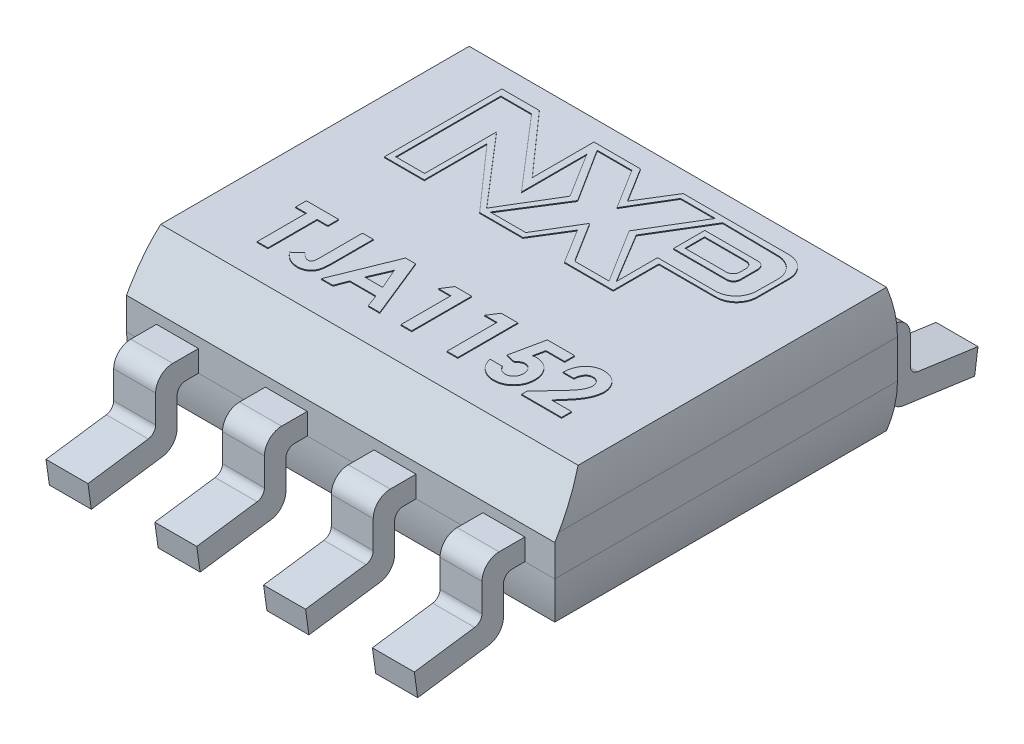
from build123d import *
from OCP.BRepAlgoAPI import BRepAlgoAPI_Cut
from OCP.TopTools import TopTools_ListOfShape

# Parameters (mm, degrees)
SKETCH1_W           = 5
SKETCH1_H           = 4
BOSS_EXTRUDE1_DEPTH = 1.45
CUT_EXTRUDE1_DEPTH  = 61.45
CUT_EXTRUDE2_DEPTH  = 61.45
BOSS_EXTRUDE2_DEPTH = 5
SKETCH7_W           = 0.35
SKETCH7_H           = 1.533953372
SKETCH7_W_2         = 0.78
SKETCH7_H_2         = 1.610570248
SKETCH7_H_3         = 1.782958217
SKETCH7_H_4         = 1.677610014
CUT_EXTRUDE3_DEPTH  = 61.45
BOSS_EXTRUDE3_DEPTH = 0.01
BOSS_EXTRUDE4_DEPTH = 0.01


with BuildPart() as part:
    # Sketch1 → Boss-Extrude1 (new body)
    with BuildSketch(Plane(origin=(0, 0, 0), x_dir=(1, 0, 0), z_dir=(0, 1, 0))):
        Rectangle(SKETCH1_W, SKETCH1_H)
    extrude(amount=BOSS_EXTRUDE1_DEPTH)

    # Sketch2 → Cut-Extrude1 (cut)
    with BuildSketch(Plane.ZY.offset(2.5)):
        Polygon((2, 0.86865368), (1.664359546, 1.45), (1.664359546, 1.731681291), (2.487143748, 1.731681291), (2.487143748, 0.86865368), align=None)
        with BuildLine():
            Line((-1.864420937, 1.672264495), (-2.155873567, 1.672264495))
            Line((-2.155873567, 1.672264495), (-2.155873567, 0.954004167))
            Line((-2.155873567, 0.954004167), (-1.999984404, 0.948389144))
            ThreePointArc((-1.999984404, 0.948389144), (-1.965805293, 1.316619369), (-1.864420937, 1.672264495))
        make_face()
        with BuildLine():
            Line((-1.999984404, 0.501610856), (-2.15587357, 0.501610856))
            Line((-2.15587357, 0.501610856), (-2.15587357, -0.22229559))
            Line((-2.15587357, -0.22229559), (-1.864420937, -0.222264495))
            ThreePointArc((-1.864420937, -0.222264495), (-1.965805293, 0.133380631), (-1.999984404, 0.501610856))
        make_face()
        with BuildLine():
            Line((2, 0.501548667), (2.487143748, 0.501548667))
            Line((2.487143748, 0.501548667), (2.487143748, -0.222291374))
            Line((2.487143748, -0.222291374), (1.864414025, -0.222322469))
            ThreePointArc((1.864414025, -0.222322469), (1.965809439, 0.133319505), (2, 0.501548667))
        make_face()
    extrude(amount=-CUT_EXTRUDE1_DEPTH, mode=Mode.SUBTRACT)


with BuildPart() as cut_extrude2_tool:
    # Sketch5 → Cut-Extrude2 (new body)
    with BuildSketch(Plane(origin=(0, 0, -2), x_dir=(-1, 0, 0), z_dir=(0, 0, -1))):
        with BuildLine():
            Line((-2.655873567, 0.954004878), (-2.499991937, 0.948390126))
            ThreePointArc((-2.499991937, 0.948390126), (-2.46581276, 1.316621068), (-2.364420937, 1.672264066))
            Line((-2.364420937, 1.672264066), (-2.655873567, 1.672264066))
            Line((-2.655873567, 1.672264066), (-2.655873567, 0.954004878))
        make_face()
        with BuildLine():
            ThreePointArc((-2.364420937, -0.222263785), (-2.46581276, 0.133379212), (-2.499991937, 0.501610155))
            Line((-2.499991937, 0.501610155), (-2.655873567, 0.495995403))
            Line((-2.65587357, 0.495995403), (-2.65587357, -0.22229488))
            Line((-2.65587357, -0.22229488), (-2.364420937, -0.222263785))
        make_face()
        with BuildLine():
            ThreePointArc((2.499991937, 0.948390126), (2.46581276, 1.316621068), (2.364420937, 1.672264066))
            Line((2.364420937, 1.672264066), (2.655873567, 1.672264066))
            Line((2.655873567, 1.672264066), (2.655873567, 0.954004878))
            Line((2.655873567, 0.954004878), (2.499991937, 0.948390126))
        make_face()
        with BuildLine():
            Line((2.499991937, 0.501610155), (2.65587357, 0.501610155))
            Line((2.65587357, 0.501610155), (2.65587357, -0.22229488))
            Line((2.65587357, -0.22229488), (2.364420937, -0.222263785))
            ThreePointArc((2.364420937, -0.222263785), (2.46581276, 0.133379212), (2.499991937, 0.501610155))
        make_face()
    extrude(amount=-CUT_EXTRUDE2_DEPTH)


with BuildPart() as part_1:
    add(part.part)

    # Cut-Extrude2: cut by cut_extrude2_tool, with a tolerance
    cut_extrude2_stock = TopTools_ListOfShape()
    cut_extrude2_stock.Append(part_1.part.wrapped)
    cut_extrude2_tools = TopTools_ListOfShape()
    cut_extrude2_tools.Append(cut_extrude2_tool.part.wrapped)
    cut_extrude2_cut = BRepAlgoAPI_Cut()
    cut_extrude2_cut.SetArguments(cut_extrude2_stock)
    cut_extrude2_cut.SetTools(cut_extrude2_tools)
    cut_extrude2_cut.SetFuzzyValue(0.00001)
    cut_extrude2_cut.Build()
    add(Compound.cast(cut_extrude2_cut.Shape()).solids(), mode=Mode.REPLACE)

    # Sketch6 → Boss-Extrude2 (add)
    with BuildSketch(Plane.ZY.offset(2.5)):
        with BuildLine():
            Line((2.300001958, 0.75), (2.253544498, 0.75))
            Line((2.253544498, 0.75), (-2.253544498, 0.75))
            Line((-2.253544498, 0.75), (-2.300001958, 0.75))
            ThreePointArc((-2.300001958, 0.75), (-2.441423314, 0.691421356), (-2.500001958, 0.55))
            Line((-2.500001958, 0.55), (-2.500001958, 0.227578594))
            ThreePointArc((-2.500001958, 0.227578594), (-2.524531, 0.161972691), (-2.586084648, 0.128551787))
            Line((-2.586084648, 0.128551787), (-3.290075098, 0.029612381))
            Line((-3.290075098, 0.029612381), (-3.250778141, -0.25))
            Line((-3.250778141, -0.25), (-2.422167338, -0.133546346))
            ThreePointArc((-2.422167338, -0.133546346), (-2.299060042, -0.066704538), (-2.250001958, 0.064507268))
            Line((-2.250001958, 0.064507268), (-2.250001958, 0.4))
            ThreePointArc((-2.250001958, 0.4), (-2.220712636, 0.470710678), (-2.150001958, 0.5))
            Line((-2.150001958, 0.5), (2.150001958, 0.5))
            ThreePointArc((2.150001958, 0.5), (2.220712636, 0.470710678), (2.250001958, 0.4))
            Line((2.250001958, 0.4), (2.250001958, 0.064507268))
            ThreePointArc((2.250001958, 0.064507268), (2.299060042, -0.066704538), (2.422167338, -0.133546346))
            Line((2.422167338, -0.133546346), (3.250778141, -0.25))
            Line((3.250778141, -0.25), (3.290075098, 0.029612381))
            Line((3.290075098, 0.029612381), (2.586084648, 0.128551787))
            ThreePointArc((2.586084648, 0.128551787), (2.524531, 0.161972691), (2.500001958, 0.227578594))
            Line((2.500001958, 0.227578594), (2.500001958, 0.55))
            ThreePointArc((2.500001958, 0.55), (2.441423314, 0.691421356), (2.300001958, 0.75))
        make_face()
    extrude(amount=-BOSS_EXTRUDE2_DEPTH)

    # Sketch7 → Cut-Extrude3 (cut)
    with BuildSketch(Plane(origin=(0, 1.45, 0), x_dir=(1, 0, 0), z_dir=(0, 1, 0))):
        with Locations((-2.325, -2.766976686)):
            Rectangle(SKETCH7_W, SKETCH7_H)
        with Locations((-1.27, -2.805285124)):
            Rectangle(SKETCH7_W_2, SKETCH7_H_2)
        with Locations((0, -2.805285124)):
            Rectangle(SKETCH7_W_2, SKETCH7_H_2)
        with Locations((2.325, -2.891479109)):
            Rectangle(SKETCH7_W, SKETCH7_H_3)
        with Locations((1.27, -2.838805007)):
            Rectangle(SKETCH7_W_2, SKETCH7_H_4)
        with Locations((1.27, 2.838805007)):
            Rectangle(SKETCH7_W_2, SKETCH7_H_4)
        with Locations((2.325, 2.891479109)):
            Rectangle(SKETCH7_W, SKETCH7_H_3)
        with Locations((0, 2.805285124)):
            Rectangle(SKETCH7_W_2, SKETCH7_H_2)
        with Locations((-1.27, 2.805285124)):
            Rectangle(SKETCH7_W_2, SKETCH7_H_2)
        with Locations((-2.325, 2.766976686)):
            Rectangle(SKETCH7_W, SKETCH7_H)
    extrude(amount=-CUT_EXTRUDE3_DEPTH, mode=Mode.SUBTRACT)

    # Sketch8 → Boss-Extrude3 (add)
    # profile 1 of 2: a face of its own
    with BuildSketch(Plane(origin=(0, 1.45, 0), x_dir=(1, 0, 0), z_dir=(0, 1, 0))):
        with BuildLine():
            Line((-1.803375496, 0.313929244), (-1.803375496, 1.686128651))
            Line((-1.803375496, 1.686128651), (-1.367177563, 1.686128651))
            Line((-1.367177563, 1.686128651), (-0.729512855, 0.965015135))
            Line((-0.729512855, 0.965015135), (-0.729512855, 1.686128651))
            Line((-0.729512855, 1.686128651), (-0.186049825, 1.686128651))
            Line((-0.186049825, 1.686128651), (0.063647762, 1.28357467))
            Line((0.063647762, 1.28357467), (0.31227987, 1.686128651))
            Line((0.31227987, 1.686128651), (1.548664193, 1.686128651))
            ThreePointArc((1.548664193, 1.686128651), (1.71836982, 1.615834278), (1.788664193, 1.446128651))
            Line((1.788664193, 1.446128651), (1.788664193, 1.073244082))
            ThreePointArc((1.788664193, 1.073244082), (1.71836982, 0.903538454), (1.548664193, 0.833244082))
            Line((1.548664193, 0.833244082), (0.881704624, 0.833244082))
            Line((0.881704624, 0.833244082), (0.881704624, 0.299873291))
            Line((0.881704624, 0.299873291), (0.31227987, 0.299873291))
            Line((0.31227987, 0.299873291), (0.063647762, 0.700709541))
            Line((0.063647762, 0.700709541), (-0.179553334, 0.306948774))
            Line((-0.179553334, 0.306948774), (-0.684190472, 0.306948774))
            Line((-0.684190472, 0.306948774), (-1.337736001, 1.046021375))
            Line((-1.337736001, 1.046021375), (-1.337736001, 0.313929244))
            Line((-1.337736001, 0.313929244), (-1.803375496, 0.313929244))
        make_face()
        Polygon((-1.737717167, 0.380080618), (-1.737717167, 1.607932124), (-1.378914568, 1.607932124), (-0.648130736, 0.758975413), (-0.648130736, 1.522116291), (-0.322062078, 0.999645994), (-0.687545107, 0.391434051), (-1.399882226, 1.218961086), (-1.399882226, 0.380080618), align=None, mode=Mode.SUBTRACT)
        Polygon((-0.627925102, 1.622168194), (-0.22215297, 1.622168194), (0.06797424, 1.157765207), (0.346386813, 1.622168194), (0.751426259, 1.622168194), (0.374330406, 0.993157662), (0.764288881, 0.368956019), (0.361905461, 0.368956019), (0.06797424, 0.839448039), (-0.211673984, 0.372983937), (-0.627925102, 0.372983937), (-0.233354138, 0.999645994), align=None, mode=Mode.SUBTRACT)
        with BuildLine():
            Line((0.838091157, 1.622168194), (1.493858319, 1.612977237))
            ThreePointArc((1.493858319, 1.612977237), (1.662562161, 1.540311479), (1.730471342, 1.369637398))
            Line((1.730471342, 1.369637398), (1.727040318, 1.124836692))
            ThreePointArc((1.727040318, 1.124836692), (1.655576174, 0.957309466), (1.487063887, 0.888200101))
            Line((1.487063887, 0.888200101), (0.811207804, 0.888200101))
            Line((0.811207804, 0.888200101), (0.811207804, 0.405870091))
            Line((0.811207804, 0.405870091), (0.45710645, 0.993157662))
            Line((0.45710645, 0.993157662), (0.838091157, 1.622168194))
        make_face(mode=Mode.SUBTRACT)
    # profile 2 of 2: a face of its own
    with BuildSketch(Plane(origin=(0, 1.45, 0), x_dir=(1, 0, 0), z_dir=(0, 1, 0))):
        with BuildLine():
            Line((0.811207804, 1.439616889), (1.43299067, 1.439616889))
            ThreePointArc((1.43299067, 1.439616889), (1.489559213, 1.416185432), (1.51299067, 1.359616889))
            Line((1.51299067, 1.359616889), (1.51299067, 1.153244082))
            ThreePointArc((1.51299067, 1.153244082), (1.489559213, 1.096675539), (1.43299067, 1.073244082))
            Line((1.43299067, 1.073244082), (0.811207804, 1.073244082))
            Line((0.811207804, 1.073244082), (0.811207804, 1.439616889))
        make_face()
        with BuildLine():
            Line((0.875476734, 1.373219945), (1.358258838, 1.373219945))
            ThreePointArc((1.358258838, 1.373219945), (1.41482738, 1.349788487), (1.438258838, 1.293219945))
            Line((1.438258838, 1.293219945), (1.438258838, 1.223991427))
            ThreePointArc((1.438258838, 1.223991427), (1.41482738, 1.167422884), (1.358258838, 1.143991427))
            Line((1.358258838, 1.143991427), (0.875476734, 1.143991427))
            Line((0.875476734, 1.143991427), (0.875476734, 1.373219945))
        make_face(mode=Mode.SUBTRACT)
    extrude(amount=BOSS_EXTRUDE3_DEPTH)

    # Sketch9 → Boss-Extrude4 (add)
    # profile 1 of 7: a face of its own
    with BuildSketch(Plane(origin=(0, 1.45, 0), x_dir=(1, 0, 0), z_dir=(0, 1, 0))):
        Polygon((-1.81434085, -0.586083303), (-1.437417773, -0.586083303), (-1.437417773, -0.711724328), (-1.563058799, -0.711724328), (-1.563058799, -1.286083303), (-1.688699825, -1.286083303), (-1.688699825, -0.711724328), (-1.81434085, -0.711724328), align=None)
    # profile 2 of 7: a face of its own
    with BuildSketch(Plane(origin=(0, 1.45, 0), x_dir=(1, 0, 0), z_dir=(0, 1, 0))):
        with BuildLine():
            Line((-1.159212645, -0.586083303), (-1.03357162, -0.586083303))
            Line((-1.03357162, -0.586083303), (-1.03357162, -1.050786828))
            add(Edge.make_bspline(
                [(-1.03357162, -1.050786828), (-1.033617683, -1.059668569), (-1.033706439, -1.076781931), (-1.034595042, -1.101418854), (-1.03579659, -1.124007236), (-1.037526935, -1.144510882), (-1.040096971, -1.162928802), (-1.043005471, -1.179306946), (-1.046214354, -1.19371205), (-1.051634945, -1.209833603), (-1.060050255, -1.227686389), (-1.072749198, -1.246969934), (-1.088563447, -1.26372405), (-1.106776238, -1.278276935), (-1.127541028, -1.289800068), (-1.150379444, -1.298129019), (-1.175218477, -1.303104792), (-1.192422632, -1.30371689), (-1.201279953, -1.304032021)],
                knots=[0, 0, 0, 0, 1.22248561, 2.355488409, 3.392943897, 4.335991845, 5.186735882, 5.951517034, 6.625683685, 7.215700098, 8.28923535, 9.333114649, 10.380102123, 11.447198135, 12.530158036, 13.633358744, 14.781567393, 16, 16, 16, 16], degree=3))
            add(Edge.make_bspline(
                [(-1.201279953, -1.304032021), (-1.210508476, -1.303746316), (-1.228710727, -1.303182795), (-1.255406203, -1.298383046), (-1.281063892, -1.290687603), (-1.305551055, -1.279560916), (-1.329203174, -1.265623237), (-1.351590985, -1.248334903), (-1.373181914, -1.228232102), (-1.385981148, -1.212805716), (-1.392545979, -1.204893399)],
                knots=[0, 0, 0, 0, 0.990984786, 1.954608977, 2.90473533, 3.862451285, 4.837525908, 5.848096122, 6.896271184, 8, 8, 8, 8], degree=3))
            Line((-1.392545979, -1.204893399), (-1.297473863, -1.116972726))
            add(Edge.make_bspline(
                [(-1.297473863, -1.116972726), (-1.292495995, -1.122601289), (-1.283181064, -1.133133845), (-1.269143738, -1.146868557), (-1.256481314, -1.157902812), (-1.24454484, -1.16586192), (-1.233280675, -1.171472202), (-1.222446464, -1.175513446), (-1.211704488, -1.17780102), (-1.204608011, -1.178197313), (-1.201139729, -1.178390995)],
                knots=[0, 0, 0, 0, 1.529509877, 2.862124173, 3.996688592, 4.944357383, 5.774364335, 6.554177287, 7.293378699, 8, 8, 8, 8], degree=3))
            add(Edge.make_bspline(
                [(-1.201139729, -1.178390995), (-1.197782817, -1.178215937), (-1.19132858, -1.177879359), (-1.182453757, -1.174137867), (-1.174971709, -1.168263568), (-1.170045971, -1.161510298), (-1.166906972, -1.154606639), (-1.164945666, -1.14793319), (-1.163084384, -1.139933535), (-1.161593166, -1.130611681), (-1.160466399, -1.119846038), (-1.159904787, -1.1077673), (-1.159221795, -1.094310196), (-1.159215804, -1.084909241), (-1.159212645, -1.079953495)],
                knots=[0, 0, 0, 0, 1.003927327, 1.930222208, 2.840933547, 3.835773585, 4.407906147, 5.114514582, 5.922289074, 6.876303333, 7.950072246, 9.174518422, 10.510537432, 12, 12, 12, 12], degree=3))
            Line((-1.159212645, -1.079953495), (-1.159212645, -0.586083303))
        make_face()
    # profile 3 of 7: a face of its own
    with BuildSketch(Plane(origin=(0, 1.45, 0), x_dir=(1, 0, 0), z_dir=(0, 1, 0))):
        Polygon((-0.656508318, -0.586083303), (-0.539981876, -0.586083303), (-0.257289568, -1.286083303), (-0.39148428, -1.286083303), (-0.445891331, -1.142493559), (-0.750879312, -1.142493559), (-0.805286363, -1.286083303), (-0.93934085, -1.286083303), align=None)
        Polygon((-0.598315209, -0.773843719), (-0.70320303, -1.016852533), (-0.493427389, -1.016852533), align=None, mode=Mode.SUBTRACT)
    # profile 4 of 7: a face of its own
    with BuildSketch(Plane(origin=(0, 1.45, 0), x_dir=(1, 0, 0), z_dir=(0, 1, 0))):
        Polygon((-0.079064408, -0.586083303), (0.115146329, -0.586083303), (0.115146329, -1.286083303), (-0.010494697, -1.286083303), (-0.010494697, -0.702749969), (-0.15408444, -0.702749969), align=None)
    # profile 5 of 7: a face of its own
    with BuildSketch(Plane(origin=(0, 1.45, 0), x_dir=(1, 0, 0), z_dir=(0, 1, 0))):
        Polygon((0.45939713, -0.586083303), (0.653607868, -0.586083303), (0.653607868, -1.286083303), (0.527966842, -1.286083303), (0.527966842, -0.702749969), (0.384377098, -0.702749969), align=None)
    # profile 6 of 7: a face of its own
    with BuildSketch(Plane(origin=(0, 1.45, 0), x_dir=(1, 0, 0), z_dir=(0, 1, 0))):
        with BuildLine():
            Line((0.998980464, -0.586083303), (1.317710432, -0.586083303))
            Line((1.317710432, -0.586083303), (1.317710432, -0.702749969))
            Line((1.317710432, -0.702749969), (1.098539759, -0.702749969))
            Line((1.098539759, -0.702749969), (1.071196009, -0.835121764))
            add(Edge.make_bspline(
                [(1.071196009, -0.835121764), (1.074921986, -0.834084032), (1.082270379, -0.832037412), (1.093340742, -0.829984911), (1.104069466, -0.828654545), (1.11110959, -0.828477092), (1.114525335, -0.828390995)],
                knots=[0, 0, 0, 0, 1.05461699, 2.079921384, 3.068411212, 4, 4, 4, 4], degree=3))
            add(Edge.make_bspline(
                [(1.114525335, -0.828390995), (1.121968603, -0.828561553), (1.136640923, -0.828897761), (1.158104665, -0.832089469), (1.178657467, -0.837116312), (1.198236433, -0.844285627), (1.216822439, -0.853616676), (1.234438013, -0.86490463), (1.251104776, -0.878169314), (1.266526657, -0.893419034), (1.280696925, -0.910163571), (1.293017165, -0.928274559), (1.303539419, -0.947493755), (1.311908456, -0.967940622), (1.318514013, -0.989486743), (1.323287336, -1.012145923), (1.326110041, -1.035945017), (1.326490665, -1.052181438), (1.326684791, -1.060462309)],
                knots=[0, 0, 0, 0, 1.01440847, 1.999622559, 2.951875003, 3.895578053, 4.836219714, 5.782137149, 6.743708247, 7.735272588, 8.734977101, 9.730283169, 10.717124674, 11.717316708, 12.737475749, 13.78628267, 14.87096371, 16, 16, 16, 16], degree=3))
            add(Edge.make_bspline(
                [(1.326684791, -1.060462309), (1.326447566, -1.068837187), (1.325979453, -1.08536327), (1.322925445, -1.109662458), (1.317535065, -1.132935594), (1.31013084, -1.15524498), (1.300376246, -1.176426648), (1.288645012, -1.196700023), (1.274738795, -1.215914624), (1.258794062, -1.233873476), (1.241460045, -1.250288212), (1.223003409, -1.264728286), (1.203553817, -1.276879492), (1.1831108, -1.286699721), (1.161791645, -1.294469311), (1.139589884, -1.300125202), (1.116397617, -1.303368541), (1.100653081, -1.30380843), (1.092650335, -1.304032021)],
                knots=[0, 0, 0, 0, 1.06808661, 2.107647099, 3.116961351, 4.110378221, 5.100014249, 6.085620622, 7.093190682, 8.119403071, 9.144090782, 10.133780668, 11.103064255, 12.062861538, 13.020824475, 13.992378307, 14.979551724, 16, 16, 16, 16], degree=3))
            add(Edge.make_bspline(
                [(1.092650335, -1.304032021), (1.085493719, -1.30384911), (1.071379373, -1.303488372), (1.050589561, -1.301271084), (1.030545874, -1.297350899), (1.011354721, -1.291677376), (0.992814181, -1.284694565), (0.975138585, -1.275961239), (0.958230805, -1.265643695), (0.942138852, -1.253930225), (0.927124196, -1.240735457), (0.91342041, -1.226291509), (0.900944528, -1.210780442), (0.889963515, -1.194010894), (0.880511793, -1.176007644), (0.872129813, -1.156982862), (0.865269079, -1.136737869), (0.861787454, -1.122702916), (0.860018124, -1.115570482)],
                knots=[0, 0, 0, 0, 1.054957082, 2.080596141, 3.077793124, 4.061112343, 5.027190972, 5.994718051, 6.962465889, 7.943658696, 8.924948258, 9.904494768, 10.875059, 11.855380583, 12.854004648, 13.869083016, 14.917087635, 16, 16, 16, 16], degree=3))
            Line((0.860018124, -1.115570482), (1.003607868, -1.115570482))
            add(Edge.make_bspline(
                [(1.003607868, -1.115570482), (1.006232692, -1.120512968), (1.011333737, -1.130118126), (1.021037054, -1.142870417), (1.031899302, -1.153745022), (1.043822496, -1.16284819), (1.056883892, -1.169668129), (1.070551263, -1.174840054), (1.084996305, -1.177828719), (1.094834017, -1.178202331), (1.099801778, -1.178390995)],
                knots=[0, 0, 0, 0, 1.104910296, 2.147267069, 3.153527244, 4.136738762, 5.099945312, 6.05603338, 7.018353, 8, 8, 8, 8], degree=3))
            add(Edge.make_bspline(
                [(1.099801778, -1.178390995), (1.10326424, -1.178260721), (1.110076693, -1.178004405), (1.120113765, -1.176648429), (1.129694592, -1.174080241), (1.138890404, -1.170523897), (1.147725903, -1.166088736), (1.15607443, -1.160489633), (1.164081234, -1.154044858), (1.171624419, -1.146649456), (1.178456371, -1.138405304), (1.184447245, -1.129546401), (1.189803912, -1.120269593), (1.193771678, -1.110207402), (1.197020942, -1.09966029), (1.199413832, -1.088548697), (1.200843854, -1.076859644), (1.200976235, -1.068879855), (1.201043765, -1.064809264)],
                knots=[0, 0, 0, 0, 0.978869489, 1.925942215, 2.855067702, 3.774946051, 4.70828698, 5.642468714, 6.60995405, 7.609372294, 8.622401667, 9.629904756, 10.629323, 11.642352373, 12.678539694, 13.745912462, 14.850161547, 16, 16, 16, 16], degree=3))
            add(Edge.make_bspline(
                [(1.201043765, -1.064809264), (1.200965389, -1.060833161), (1.200812828, -1.05309358), (1.199550817, -1.041729102), (1.197293102, -1.030946269), (1.194216946, -1.020662493), (1.1902791, -1.010940222), (1.185466788, -1.001721584), (1.179759453, -0.993053175), (1.173126452, -0.985111477), (1.166053088, -0.977827126), (1.158454022, -0.97145629), (1.150397718, -0.966168939), (1.142134516, -0.961552927), (1.133334578, -0.958193494), (1.124195779, -0.955879977), (1.11472773, -0.954182411), (1.108269779, -0.954082673), (1.104990079, -0.954032021)],
                knots=[0, 0, 0, 0, 1.166249705, 2.270133367, 3.348514167, 4.393962215, 5.415026464, 6.420877785, 7.440098956, 8.453121383, 9.451844239, 10.415694839, 11.355045125, 12.27538808, 13.187007209, 14.108269027, 15.039275622, 16, 16, 16, 16], degree=3))
            add(Edge.make_bspline(
                [(1.104990079, -0.954032021), (1.101427562, -0.954167198), (1.094287515, -0.954438123), (1.08367919, -0.956642569), (1.073198773, -0.960210189), (1.062787981, -0.965132286), (1.052550159, -0.971573758), (1.042215126, -0.979128866), (1.032128818, -0.98834656), (1.025715663, -0.99521192), (1.022397932, -0.998763591)],
                knots=[0, 0, 0, 0, 0.88288272, 1.769486374, 2.674910571, 3.623812639, 4.617874466, 5.670434592, 6.794841017, 8, 8, 8, 8], degree=3))
            Line((1.022397932, -0.998763591), (0.916668765, -0.974504777))
            Line((0.916668765, -0.974504777), (0.998980464, -0.586083303))
        make_face()
    # profile 7 of 7: a face of its own
    with BuildSketch(Plane(origin=(0, 1.45, 0), x_dir=(1, 0, 0), z_dir=(0, 1, 0))):
        with BuildLine():
            Line((1.542069406, -0.819416636), (1.41642838, -0.819416636))
            add(Edge.make_bspline(
                [(1.41642838, -0.819416636), (1.416971005, -0.809912557), (1.41803126, -0.791342157), (1.422248688, -0.764368058), (1.427899896, -0.738880499), (1.435442184, -0.714968641), (1.444919563, -0.692641171), (1.456088154, -0.671821975), (1.46923329, -0.652620665), (1.4840752, -0.635129842), (1.500361908, -0.619438663), (1.517755287, -0.605525878), (1.536521392, -0.594045397), (1.55631735, -0.584598025), (1.577139791, -0.577050014), (1.599185728, -0.572003557), (1.622264275, -0.568586048), (1.638063409, -0.568287002), (1.64611588, -0.568134585)],
                knots=[0, 0, 0, 0, 1.199038563, 2.342849363, 3.436047546, 4.486744587, 5.497670872, 6.488682221, 7.459191391, 8.424610317, 9.374430501, 10.305433194, 11.225809216, 12.140057399, 13.06607119, 14.010487599, 14.985989317, 16, 16, 16, 16], degree=3))
            add(Edge.make_bspline(
                [(1.64611588, -0.568134585), (1.656000174, -0.568443001), (1.675296632, -0.569045101), (1.703335916, -0.574181217), (1.729521542, -0.582772164), (1.753834475, -0.594775984), (1.776067734, -0.610025578), (1.796217634, -0.628208223), (1.813674808, -0.649705401), (1.82854994, -0.673622649), (1.840909398, -0.698947649), (1.849570391, -0.725134748), (1.855263168, -0.751489049), (1.855870338, -0.7692347), (1.85617197, -0.77805045)],
                knots=[0, 0, 0, 0, 1.075374347, 2.099382735, 3.09057751, 4.06680945, 5.040638231, 6.016817125, 7.011024321, 8.044445721, 9.0776792, 10.070479129, 11.0414456, 12, 12, 12, 12], degree=3))
            add(Edge.make_bspline(
                [(1.85617197, -0.77805045), (1.85605453, -0.783382838), (1.855818154, -0.794115619), (1.854174593, -0.81035695), (1.851708928, -0.826900645), (1.847991306, -0.843732519), (1.843355127, -0.86085729), (1.837730772, -0.878326206), (1.830987777, -0.896040225), (1.823238671, -0.914198716), (1.813993967, -0.932860632), (1.803229795, -0.952305723), (1.790660449, -0.972516738), (1.77643775, -0.993607797), (1.760492623, -1.015545635), (1.742747228, -1.038264168), (1.723405951, -1.06184345), (1.709678903, -1.077604876), (1.702626297, -1.085702694)],
                knots=[0, 0, 0, 0, 0.728284026, 1.46585585, 2.227944881, 3.01186502, 3.81876927, 4.650621989, 5.517437689, 6.406905708, 7.346299482, 8.360816762, 9.441613733, 10.596154504, 11.834900912, 13.145207542, 14.533280747, 16, 16, 16, 16], degree=3))
            Line((1.702626297, -1.085702694), (1.629569406, -1.169416636))
            Line((1.629569406, -1.169416636), (1.865146329, -1.169416636))
            Line((1.865146329, -1.169416636), (1.865146329, -1.286083303))
            Line((1.865146329, -1.286083303), (1.398479662, -1.286083303))
            Line((1.398479662, -1.286083303), (1.398479662, -1.222421444))
            Line((1.398479662, -1.222421444), (1.605731265, -1.001848527))
            add(Edge.make_bspline(
                [(1.605731265, -1.001848527), (1.611731731, -0.995414346), (1.623352856, -0.982953247), (1.639888518, -0.964652797), (1.654851831, -0.947286106), (1.667932519, -0.930668255), (1.67981704, -0.915338259), (1.689975464, -0.900834053), (1.698500732, -0.88728676), (1.70775612, -0.870951091), (1.716545696, -0.851467898), (1.724610664, -0.829022461), (1.72952682, -0.807569793), (1.730205405, -0.793590773), (1.730530944, -0.786884585)],
                knots=[0, 0, 0, 0, 1.246127091, 2.413378631, 3.493388633, 4.492180848, 5.408488754, 6.240484944, 6.999099869, 7.674939598, 8.898438119, 10.020720584, 11.050475521, 12, 12, 12, 12], degree=3))
            add(Edge.make_bspline(
                [(1.730530944, -0.786884585), (1.730287547, -0.780396864), (1.729815924, -0.767825866), (1.724633178, -0.749943688), (1.716603887, -0.733753201), (1.705289482, -0.719738196), (1.691584194, -0.708221136), (1.675746447, -0.699655071), (1.657905364, -0.694712491), (1.645398425, -0.694093856), (1.638964438, -0.69377561)],
                knots=[0, 0, 0, 0, 1.062038974, 2.057870785, 3.028805853, 4.01125022, 4.991535629, 5.949134679, 6.94496649, 8, 8, 8, 8], degree=3))
            add(Edge.make_bspline(
                [(1.638964438, -0.69377561), (1.635640559, -0.693893174), (1.629096968, -0.694124618), (1.619478402, -0.695665275), (1.610325645, -0.698380522), (1.601536822, -0.702018571), (1.59320573, -0.706840831), (1.585353382, -0.712785035), (1.577897045, -0.719700127), (1.570870915, -0.727564484), (1.56447622, -0.736341109), (1.558796475, -0.745949845), (1.554100271, -0.756384729), (1.549965563, -0.767508002), (1.546776678, -0.779439139), (1.544454774, -0.792106733), (1.542689586, -0.805490175), (1.542279893, -0.814690033), (1.542069406, -0.819416636)],
                knots=[0, 0, 0, 0, 0.903469896, 1.778625579, 2.63899355, 3.493148037, 4.358286772, 5.247621495, 6.164656832, 7.118446693, 8.109501108, 9.111810964, 10.146451449, 11.215617525, 12.33435995, 13.498009769, 14.714554818, 16, 16, 16, 16], degree=3))
        make_face()
    extrude(amount=BOSS_EXTRUDE4_DEPTH)


solid = part_1.part
